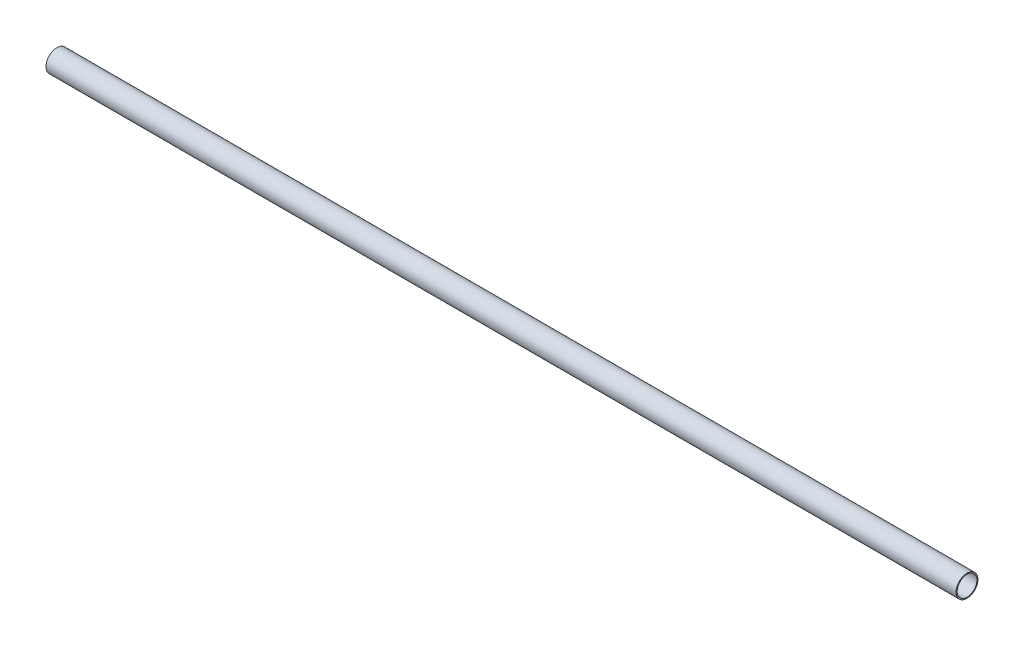
from build123d import *

# Parameters (mm, degrees)
SKETCH_1_R      = 5
SKETCH_1_R_2    = 4.5
EXTRUDE_1_DEPTH = 415


with BuildPart() as part:
    # 草图1 → 凸台-拉伸1 (new body)
    with BuildSketch(Plane(origin=(0, 0, 0), x_dir=(0, 0, -1), z_dir=(1, 0, 0))):
        Circle(SKETCH_1_R)
        Circle(SKETCH_1_R_2, mode=Mode.SUBTRACT)
    extrude(amount=EXTRUDE_1_DEPTH)


solid = part.part
